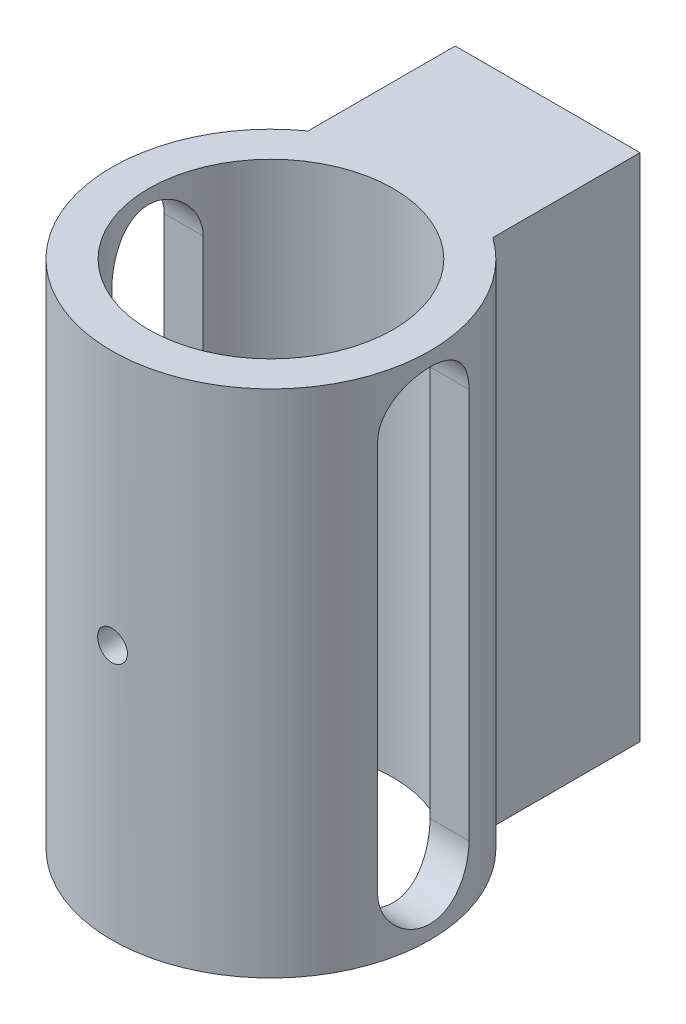
from build123d import *

# Parameters (mm, degrees)
SKETCH1_R                = 11.5
SKETCH1_R_2              = 8.8383
BOSS_EXTRUDE1_DEPTH      = 36.88
CUT_EXTRUDE1_DEPTH       = 55.88
SKETCH3_R                = 1.075360457
CUT_EXTRUDE2_DEPTH       = 41.306753925
BOSS_EXTRUDE2_REACH      = 62.307
BOSS_EXTRUDE2_END_RADIUS = 11.5
BOSS_EXTRUDE2_START      = -20
SKETCH4_W                = 13.356191656
SKETCH4_H                = 36.88


with BuildPart() as part:
    # Sketch1 → Boss-Extrude1 (new body)
    with BuildSketch(Plane(origin=(0, 0, 0), x_dir=(1, 0, 0), z_dir=(0, 1, 0))):
        Circle(SKETCH1_R)
        Circle(SKETCH1_R_2, mode=Mode.SUBTRACT)
    extrude(amount=BOSS_EXTRUDE1_DEPTH)

    # Sketch2 → Cut-Extrude1 (cut)
    with BuildSketch(Plane.ZY.offset(11.5)):
        with BuildLine():
            Line((3.302, 32.573327327), (3.302, 4.306672673))
            ThreePointArc((3.302, 4.306672673), (0, 1.004672673), (-3.302, 4.306672673))
            Line((-3.302, 4.306672673), (-3.302, 32.573327327))
            ThreePointArc((-3.302, 32.573327327), (0, 35.875327327), (3.302, 32.573327327))
        make_face()
    extrude(amount=-CUT_EXTRUDE1_DEPTH, mode=Mode.SUBTRACT)

    # Sketch3 → Cut-Extrude2 (cut, through all)
    with BuildSketch(Plane.XY):
        with Locations((0, 18.44)):
            Circle(SKETCH3_R)
    extrude(amount=CUT_EXTRUDE2_DEPTH, mode=Mode.SUBTRACT)

    # Boss-Extrude2: up to this cylinder (the profile starts outside it)
    boss_extrude2_end = Plane(origin=(0, 18.44, 0), z_dir=(0, -1, 0)) * Cylinder(BOSS_EXTRUDE2_END_RADIUS, 148.614, mode=Mode.PRIVATE)
    # Sketch4 → Boss-Extrude2 (add, up to the surface)
    with BuildSketch(Plane.XY.offset(BOSS_EXTRUDE2_START), mode=Mode.PRIVATE) as boss_extrude2_sk1:
        with Locations((0, 18.44)):
            Rectangle(SKETCH4_W, SKETCH4_H)
    boss_extrude2_tool1 = extrude(boss_extrude2_sk1.sketch, amount=BOSS_EXTRUDE2_REACH, mode=Mode.PRIVATE) - boss_extrude2_end
    add(boss_extrude2_tool1.solids().sort_by_distance((0, 18.44, -20))[0])


solid = part.part
